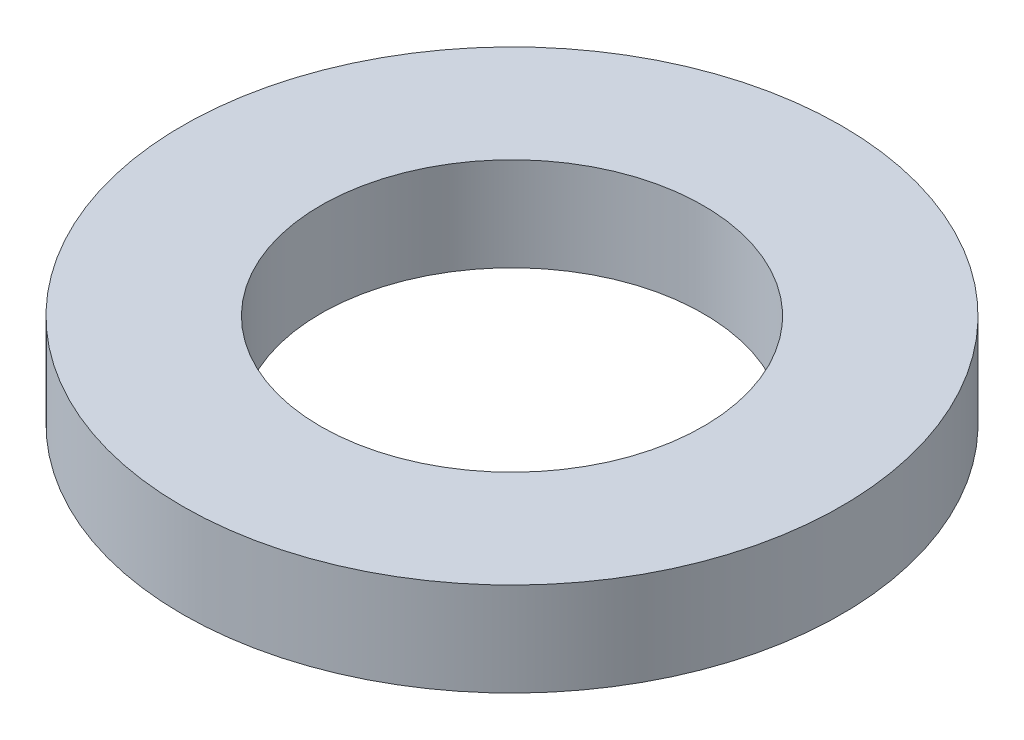
from build123d import *

# Parameters (mm, degrees)
SKETCH1_R           = 77.5
BOSS_EXTRUDE1_DEPTH = 22
SKETCH2_R           = 45
CUT_EXTRUDE1_DEPTH  = 112.787745303


with BuildPart() as part:
    # Sketch1 → Boss-Extrude1 (new body)
    with BuildSketch(Plane(origin=(0, 0, 0), x_dir=(1, 0, 0), z_dir=(0, 1, 0))):
        Circle(SKETCH1_R)
    extrude(amount=BOSS_EXTRUDE1_DEPTH)

    # Sketch2 → Cut-Extrude1 (cut, through all)
    with BuildSketch(Plane(origin=(0, 0, 0), x_dir=(1, 0, 0), z_dir=(0, 1, 0))):
        Circle(SKETCH2_R)
    extrude(amount=CUT_EXTRUDE1_DEPTH, mode=Mode.SUBTRACT)


solid = part.part
